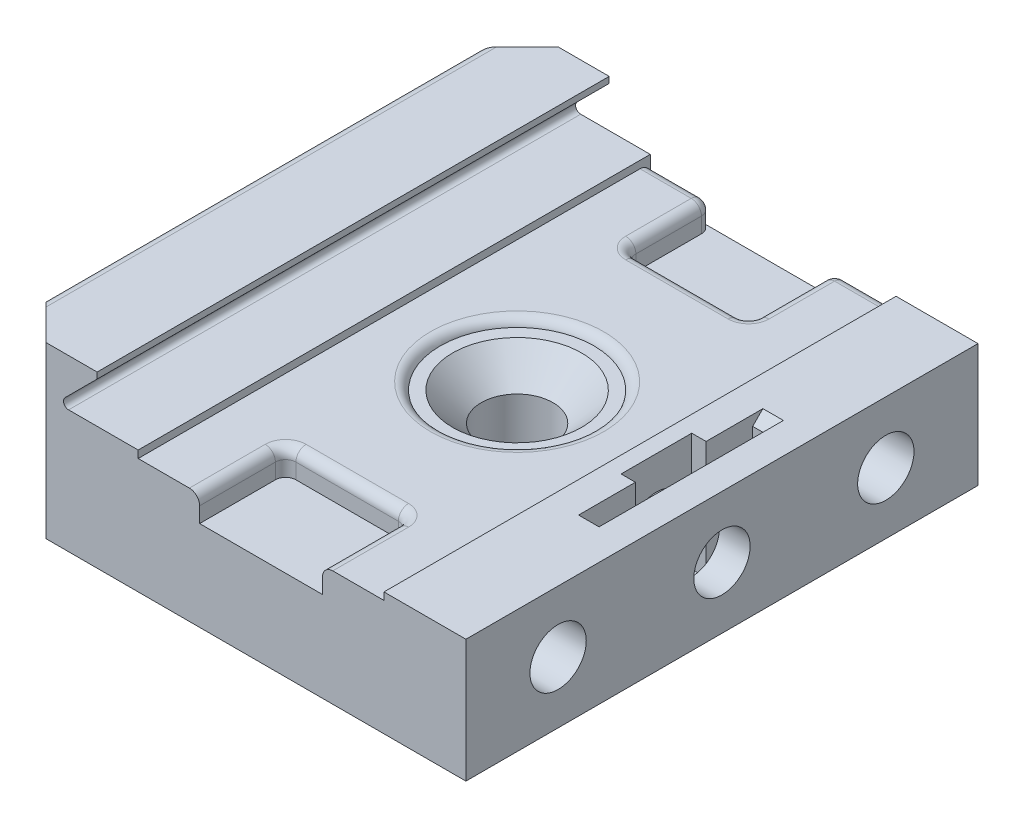
from build123d import *

# Parameters (mm, degrees)
SKETCH1_W                                       = 45
SKETCH1_H                                       = 50
BOSS_EXTRUDE1_DEPTH                             = 16
CUT_EXTRUDE1_DEPTH                              = 58.116109812
SKETCH4_W                                       = 24
SKETCH4_H                                       = 50
CUT_EXTRUDE2_DEPTH                              = 0.72
CUT_EXTRUDE3_DEPTH                              = 58.116109812
SKETCH8_R                                       = 7.5
CUT_EXTRUDE4_DEPTH                              = 0.72
CSK_FOR_M6_FLAT_HEAD_MACHINE_SCREW1_D           = 7
CSK_FOR_M6_FLAT_HEAD_MACHINE_SCREW1_CSINK_D     = 12.6
CSK_FOR_M6_FLAT_HEAD_MACHINE_SCREW1_CSINK_ANGLE = 90
CUT_EXTRUDE5_DEPTH                              = 2.5
FILLET1_R                                       = 1
FILLET2_R                                       = 1
FILLET4_R                                       = 0.5
CUT_EXTRUDE7_DEPTH                              = 11.5
SKETCH18_R                                      = 2.75
CUT_EXTRUDE8_DEPTH                              = 14.5
SKETCH19_R                                      = 2.75
CUT_EXTRUDE9_DEPTH                              = 10
SKETCH21_W                                      = 8.99
SKETCH21_H                                      = 50
BOSS_EXTRUDE2_DEPTH                             = 0.6
CHAMFER1_SIZE                                   = 4
FILLET5_R                                       = 1
CHAMFER2_SIZE                                   = 1


with BuildPart() as part:
    # Sketch1 → Boss-Extrude1 (new body)
    with BuildSketch(Plane(origin=(0, 0, 0), x_dir=(1, 0, 0), z_dir=(0, 1, 0))):
        Rectangle(SKETCH1_W, SKETCH1_H)
    extrude(amount=BOSS_EXTRUDE1_DEPTH)

    # Sketch3 → Cut-Extrude1 (cut, through all)
    with BuildSketch(Plane.XY.offset(25)):
        Polygon((-13.5, 16), (-17.5, 12), (22.5, 12), (22.5, 16), align=None)
    extrude(amount=-CUT_EXTRUDE1_DEPTH, mode=Mode.SUBTRACT)

    # Sketch4 → Cut-Extrude2 (cut)
    with BuildSketch(Plane(origin=(0, 12, 0), x_dir=(1, 0, 0), z_dir=(0, 1, 0))):
        with Locations((2.5, 0)):
            Rectangle(SKETCH4_W, SKETCH4_H)
    extrude(amount=-CUT_EXTRUDE2_DEPTH, mode=Mode.SUBTRACT)

    # Sketch5 → Cut-Extrude3 (cut, through all)
    with BuildSketch(Plane.XY.offset(25)):
        Polygon((-22.5, 16), (-13.5, 16), (-13.51, 15.99), (-22.5, 15.99), align=None)
    extrude(amount=-CUT_EXTRUDE3_DEPTH, mode=Mode.SUBTRACT)

    # Sketch8 → Cut-Extrude4 (cut)
    with BuildSketch(Plane(origin=(0, 11.28, 0), x_dir=(1, 0, 0), z_dir=(0, 1, 0))):
        with Locations(Location((2.5, 0, 0), (0, 0, 180))):
            Circle(SKETCH8_R)
    extrude(amount=-CUT_EXTRUDE4_DEPTH, mode=Mode.SUBTRACT)

    # CSK for M6 Flat Head Machine Screw1 (through all)
    with Locations(Plane(origin=(0, 10.56, 0), x_dir=(1, 0, 0), z_dir=(0, 1, 0))):
        with Locations((2.5, 0)):
            CounterSinkHole(CSK_FOR_M6_FLAT_HEAD_MACHINE_SCREW1_D / 2, CSK_FOR_M6_FLAT_HEAD_MACHINE_SCREW1_CSINK_D / 2, counter_sink_angle=CSK_FOR_M6_FLAT_HEAD_MACHINE_SCREW1_CSINK_ANGLE)

    # Sketch12 → Cut-Extrude5 (cut)
    with BuildSketch(Plane(origin=(0, 11.28, 0), x_dir=(1, 0, 0), z_dir=(0, 1, 0))):
        with BuildLine():
            Line((7.5, 16.6), (-2.5, 16.6))
            ThreePointArc((-2.5, 16.6), (-3.207106781, 16.892893219), (-3.5, 17.6))
            Line((-3.5, 17.6), (-3.5, 25))
            Line((-3.5, 25), (8.5, 25))
            Line((8.5, 25), (8.5, 17.6))
            ThreePointArc((8.5, 17.6), (8.207106781, 16.892893219), (7.5, 16.6))
        make_face()
    cut_extrude5 = extrude(amount=-CUT_EXTRUDE5_DEPTH, mode=Mode.SUBTRACT)

    # Fillet1
    fillet1_edges = [part.edges().sort_by_distance(p)[0] for p in [
        (-3.5, 10.03, -25),
        (8.5, 10.03, -25),
    ]]
    fillet(fillet1_edges, radius=FILLET1_R)

    # Mirror2: Cut-Extrude5 across plane
    add(cut_extrude5.mirror(Plane.XY), mode=Mode.SUBTRACT)

    # Fillet2
    # the kernel refuses this fillet: 1 mm, written as the material it takes off along each edge
    with BuildSketch(Plane(origin=(7.5, 11.28, 17.6), x_dir=(1, 0, 0), z_dir=(0, 0, 1))) as fillet2_piece_1:
        with BuildLine():
            CenterArc((1 + FILLET2_R, -FILLET2_R), FILLET2_R, 90, 90)
            Line((1, -FILLET2_R), (1 - FILLET2_R * 0.02, -FILLET2_R))
            Line((1 - FILLET2_R * 0.02, -FILLET2_R), (1 - FILLET2_R * 0.02, FILLET2_R * 0.02))
            Line((1 - FILLET2_R * 0.02, FILLET2_R * 0.02), (1 + FILLET2_R, FILLET2_R * 0.02))
            Line((1 + FILLET2_R, FILLET2_R * 0.02), (1 + FILLET2_R, 0))
        make_face()
    revolve(axis=Axis((7.5, 11.28, 17.6), (0, 1, 0)), revolution_arc=90, mode=Mode.SUBTRACT)
    with BuildSketch(Plane(origin=(8.5, 11.28, 27.5), x_dir=(1, 0, 0), z_dir=(0, 0, -1)), Plane(origin=(-3.5, 11.28, 17.6), x_dir=(-1, 0, 0), z_dir=(0, 0, 1))) as fillet2_piece_2:
        with BuildLine():
            CenterArc((FILLET2_R, FILLET2_R), FILLET2_R, 180, 90)
            Line((0, FILLET2_R), (-FILLET2_R * 0.02, FILLET2_R))
            Line((-FILLET2_R * 0.02, FILLET2_R), (-FILLET2_R * 0.02, -FILLET2_R * 0.02))
            Line((-FILLET2_R * 0.02, -FILLET2_R * 0.02), (FILLET2_R, -FILLET2_R * 0.02))
            Line((FILLET2_R, -FILLET2_R * 0.02), (FILLET2_R, 0))
        make_face()
    extrude(amount=9.9, mode=Mode.SUBTRACT)
    with BuildSketch(Plane(origin=(-2.5, 11.28, 17.6), x_dir=(0, 0, -1), z_dir=(1, 0, 0))) as fillet2_piece_3:
        with BuildLine():
            CenterArc((1 + FILLET2_R, -FILLET2_R), FILLET2_R, 90, 90)
            Line((1, -FILLET2_R), (1 - FILLET2_R * 0.02, -FILLET2_R))
            Line((1 - FILLET2_R * 0.02, -FILLET2_R), (1 - FILLET2_R * 0.02, FILLET2_R * 0.02))
            Line((1 - FILLET2_R * 0.02, FILLET2_R * 0.02), (1 + FILLET2_R, FILLET2_R * 0.02))
            Line((1 + FILLET2_R, FILLET2_R * 0.02), (1 + FILLET2_R, 0))
        make_face()
    revolve(axis=Axis((-2.5, 11.28, 17.6), (0, 1, 0)), revolution_arc=90, mode=Mode.SUBTRACT)
    with BuildSketch(Plane(origin=(7.5, 11.28, 16.6), x_dir=(0, 0, -1), z_dir=(-1, 0, 0))) as fillet2_piece_4:
        with BuildLine():
            CenterArc((FILLET2_R, FILLET2_R), FILLET2_R, 180, 90)
            Line((0, FILLET2_R), (-FILLET2_R * 0.02, FILLET2_R))
            Line((-FILLET2_R * 0.02, FILLET2_R), (-FILLET2_R * 0.02, -FILLET2_R * 0.02))
            Line((-FILLET2_R * 0.02, -FILLET2_R * 0.02), (FILLET2_R, -FILLET2_R * 0.02))
            Line((FILLET2_R, -FILLET2_R * 0.02), (FILLET2_R, 0))
        make_face()
    extrude(amount=10, mode=Mode.SUBTRACT)
    with BuildSketch(Plane(origin=(-4.5, 11.28, -25), x_dir=(0, 0, 1), z_dir=(-1, 0, 0)), Plane(origin=(14.5, 11.28, -25), x_dir=(0, 0, 1), z_dir=(-1, 0, 0))) as fillet2_piece_5:
        with BuildLine():
            CenterArc((FILLET2_R, -FILLET2_R), FILLET2_R, 90, 90)
            Line((0, -FILLET2_R), (-FILLET2_R * 0.02, -FILLET2_R))
            Line((-FILLET2_R * 0.02, -FILLET2_R), (-FILLET2_R * 0.02, FILLET2_R * 0.02))
            Line((-FILLET2_R * 0.02, FILLET2_R * 0.02), (FILLET2_R, FILLET2_R * 0.02))
            Line((FILLET2_R, FILLET2_R * 0.02), (FILLET2_R, 0))
        make_face()
    extrude(amount=5, mode=Mode.SUBTRACT)
    with BuildSketch(Plane(origin=(2.5, 11.28, 0), x_dir=(-1, 0, 0), z_dir=(0, 0, -1))) as fillet2_piece_6:
        with BuildLine():
            CenterArc((8.46, -1), FILLET2_R, 90, 73.739795292)
            Line((7.5, -0.72), (7.4808, -0.7144))
            ThreePointArc((7.4808, -0.7144), (7.48, -0.36), (7.48, 0))
            Line((7.48, 0), (7.5, 0.02))
            Line((7.5, 0.02), (8.46, 0.02))
            Line((8.46, 0.02), (8.46, 0))
        make_face()
    revolve(axis=Axis((2.5, 11.28, 0), (0, 1, 0)), mode=Mode.SUBTRACT)
    with BuildSketch(Plane(origin=(7.5, 11.28, -17.6), x_dir=(1, 0, 0), z_dir=(0, 0, -1))) as fillet2_piece_7:
        with BuildLine():
            CenterArc((1 + FILLET2_R, FILLET2_R), FILLET2_R, 180, 90)
            Line((1, FILLET2_R), (1 - FILLET2_R * 0.02, FILLET2_R))
            Line((1 - FILLET2_R * 0.02, FILLET2_R), (1 - FILLET2_R * 0.02, -FILLET2_R * 0.02))
            Line((1 - FILLET2_R * 0.02, -FILLET2_R * 0.02), (1 + FILLET2_R, -FILLET2_R * 0.02))
            Line((1 + FILLET2_R, -FILLET2_R * 0.02), (1 + FILLET2_R, 0))
        make_face()
    revolve(axis=Axis((7.5, 11.28, -17.6), (0, -1, 0)), revolution_arc=90, mode=Mode.SUBTRACT)
    with BuildSketch(Plane(origin=(8.5, 11.28, -24), x_dir=(1, 0, 0), z_dir=(0, 0, 1)), Plane(origin=(-3.5, 11.28, -17.6), x_dir=(-1, 0, 0), z_dir=(0, 0, -1))) as fillet2_piece_8:
        with BuildLine():
            CenterArc((FILLET2_R, -FILLET2_R), FILLET2_R, 90, 90)
            Line((0, -FILLET2_R), (-FILLET2_R * 0.02, -FILLET2_R))
            Line((-FILLET2_R * 0.02, -FILLET2_R), (-FILLET2_R * 0.02, FILLET2_R * 0.02))
            Line((-FILLET2_R * 0.02, FILLET2_R * 0.02), (FILLET2_R, FILLET2_R * 0.02))
            Line((FILLET2_R, FILLET2_R * 0.02), (FILLET2_R, 0))
        make_face()
    extrude(amount=6.4, mode=Mode.SUBTRACT)
    with BuildSketch(Plane(origin=(-2.5, 11.28, -17.6), x_dir=(0, 0, 1), z_dir=(1, 0, 0))) as fillet2_piece_9:
        with BuildLine():
            CenterArc((1 + FILLET2_R, FILLET2_R), FILLET2_R, 180, 90)
            Line((1, FILLET2_R), (1 - FILLET2_R * 0.02, FILLET2_R))
            Line((1 - FILLET2_R * 0.02, FILLET2_R), (1 - FILLET2_R * 0.02, -FILLET2_R * 0.02))
            Line((1 - FILLET2_R * 0.02, -FILLET2_R * 0.02), (1 + FILLET2_R, -FILLET2_R * 0.02))
            Line((1 + FILLET2_R, -FILLET2_R * 0.02), (1 + FILLET2_R, 0))
        make_face()
    revolve(axis=Axis((-2.5, 11.28, -17.6), (0, -1, 0)), revolution_arc=90, mode=Mode.SUBTRACT)
    with BuildSketch(Plane(origin=(7.5, 11.28, -16.6), x_dir=(0, 0, 1), z_dir=(-1, 0, 0))) as fillet2_piece_10:
        with BuildLine():
            CenterArc((FILLET2_R, -FILLET2_R), FILLET2_R, 90, 90)
            Line((0, -FILLET2_R), (-FILLET2_R * 0.02, -FILLET2_R))
            Line((-FILLET2_R * 0.02, -FILLET2_R), (-FILLET2_R * 0.02, FILLET2_R * 0.02))
            Line((-FILLET2_R * 0.02, FILLET2_R * 0.02), (FILLET2_R, FILLET2_R * 0.02))
            Line((FILLET2_R, FILLET2_R * 0.02), (FILLET2_R, 0))
        make_face()
    extrude(amount=10, mode=Mode.SUBTRACT)
    with BuildSketch(Plane(origin=(-4.5, 11.28, -24), x_dir=(0, 0, -1), z_dir=(-1, 0, 0))) as fillet2_piece_11:
        with BuildLine():
            CenterArc((1 - FILLET2_R, FILLET2_R), FILLET2_R, 270, 90)
            Line((1, FILLET2_R), (1 + FILLET2_R * 0.02, FILLET2_R))
            Line((1 + FILLET2_R * 0.02, FILLET2_R), (1 + FILLET2_R * 0.02, 0))
            Line((1 + FILLET2_R * 0.02, 0), (1, -FILLET2_R * 0.02))
            Line((1, -FILLET2_R * 0.02), (1 - FILLET2_R, -FILLET2_R * 0.02))
            Line((1 - FILLET2_R, -FILLET2_R * 0.02), (1 - FILLET2_R, 0))
        make_face()
    revolve(axis=Axis((-4.5, 11.28, -24), (0, -1, 0)), revolution_arc=90, mode=Mode.SUBTRACT)
    with BuildSketch(Plane(origin=(9.5, 11.28, -24), x_dir=(0, 0, -1), z_dir=(1, 0, 0))) as fillet2_piece_12:
        with BuildLine():
            CenterArc((1 - FILLET2_R, -FILLET2_R), FILLET2_R, 0, 90)
            Line((1, -FILLET2_R), (1 + FILLET2_R * 0.02, -FILLET2_R))
            Line((1 + FILLET2_R * 0.02, -FILLET2_R), (1 + FILLET2_R * 0.02, 0))
            Line((1 + FILLET2_R * 0.02, 0), (1, FILLET2_R * 0.02))
            Line((1, FILLET2_R * 0.02), (1 - FILLET2_R, FILLET2_R * 0.02))
            Line((1 - FILLET2_R, FILLET2_R * 0.02), (1 - FILLET2_R, 0))
        make_face()
    revolve(axis=Axis((9.5, 11.28, -24), (0, 1, 0)), revolution_arc=90, mode=Mode.SUBTRACT)

    # Fillet4
    fillet4_edges = [part.edges().sort_by_distance(p)[0] for p in [
        (-17.5, 12, 0),
    ]]
    fillet(fillet4_edges, radius=FILLET4_R)

    # Sketch14 → Cut-Extrude7 (cut)
    with BuildSketch(Plane(origin=(0, 12, 0), x_dir=(1, 0, 0), z_dir=(0, 1, 0))):
        Polygon((19.5, -8), (17.5, -8), (17.5, -3.45), (16.1, -3.45), (16.1, 3.45), (17.5, 3.45), (17.5, 8), (19.5, 8), align=None)
    extrude(amount=-CUT_EXTRUDE7_DEPTH, mode=Mode.SUBTRACT)

    # Sketch18 → Cut-Extrude8 (cut)
    with BuildSketch(Plane(origin=(22.5, 0, 0), x_dir=(0, 0, -1), z_dir=(1, 0, 0))):
        with Locations((0, 6)):
            Circle(SKETCH18_R)
    extrude(amount=-CUT_EXTRUDE8_DEPTH, mode=Mode.SUBTRACT)

    # Sketch19 → Cut-Extrude9 (cut)
    with BuildSketch(Plane(origin=(22.5, 0, 0), x_dir=(0, 0, -1), z_dir=(1, 0, 0))):
        with Locations((-16, 6)):
            Circle(SKETCH19_R)
        with Locations((16, 6)):
            Circle(SKETCH19_R)
    extrude(amount=-CUT_EXTRUDE9_DEPTH, mode=Mode.SUBTRACT)

    # Sketch21 → Boss-Extrude2 (add)
    with BuildSketch(Plane(origin=(0, 15.99, 0), x_dir=(1, 0, 0), z_dir=(0, 1, 0))):
        with Locations((-18.005, 0)):
            Rectangle(SKETCH21_W, SKETCH21_H)
    extrude(amount=BOSS_EXTRUDE2_DEPTH)

    # Chamfer1
    chamfer1_edges = [part.edges().sort_by_distance(p)[0] for p in [
        (-22.5, 8.295, 25),
        (-22.5, 8.295, -25),
    ]]
    chamfer(chamfer1_edges, length=CHAMFER1_SIZE)

    # Fillet5
    fillet5_edges = [part.edges().sort_by_distance(p)[0] for p in [
        (-22.5, 16.59, 0),
    ]]
    fillet(fillet5_edges, radius=FILLET5_R)

    # Chamfer2
    chamfer2_edges = [part.edges().sort_by_distance(p)[0] for p in [
        (18.5, 12, 8),
        (18.5, 12, -8),
    ]]
    chamfer(chamfer2_edges, length=CHAMFER2_SIZE)


solid = part.part
